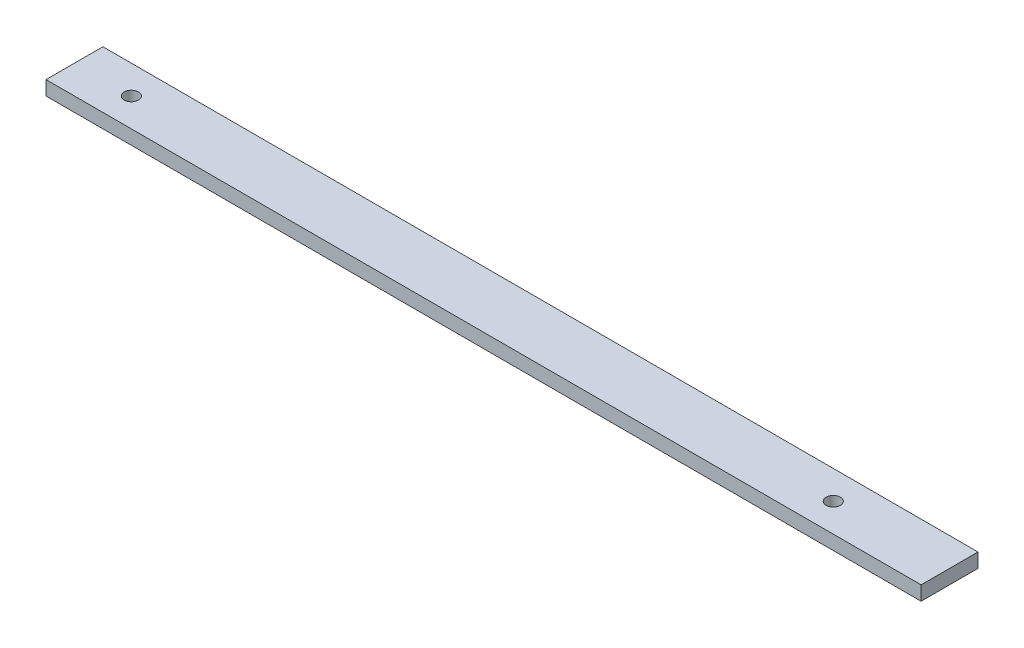
from build123d import *

# Parameters (mm, degrees)
SKETCH1_W           = 390.652
SKETCH1_H           = 25.4
BOSS_EXTRUDE1_DEPTH = 6.35
CUT_EXTRUDE1_REACH  = 393.528
SKETCH2_R           = 3.175


with BuildPart() as part:
    # Sketch1 → Boss-Extrude1 (new body)
    with BuildSketch(Plane(origin=(0, 0, 0), x_dir=(1, 0, 0), z_dir=(0, 1, 0))):
        with Locations((195.326, -12.7)):
            Rectangle(SKETCH1_W, SKETCH1_H)
    extrude(amount=BOSS_EXTRUDE1_DEPTH)

    # Sketch2 → Cut-Extrude1 (cut, up to next)
    with BuildSketch(Plane.XZ, mode=Mode.PRIVATE) as cut_extrude1_sk1:
        with Locations((25.4, 12.7)):
            Circle(SKETCH2_R)
    cut_extrude1_tool1 = extrude(cut_extrude1_sk1.sketch, amount=-CUT_EXTRUDE1_REACH, mode=Mode.PRIVATE) & part.part
    # Sketch2 → Cut-Extrude1 (cut, up to next)
    with BuildSketch(Plane.XZ, mode=Mode.PRIVATE) as cut_extrude1_sk2:
        with Locations((338.738972, 12.7)):
            Circle(SKETCH2_R)
    cut_extrude1_tool2 = extrude(cut_extrude1_sk2.sketch, amount=-CUT_EXTRUDE1_REACH, mode=Mode.PRIVATE) & part.part
    add(cut_extrude1_tool1.solids().sort_by_distance((25.4, 0, 12.7))[0], mode=Mode.SUBTRACT)
    add(cut_extrude1_tool2.solids().sort_by_distance((338.738972, 0, 12.7))[0], mode=Mode.SUBTRACT)


solid = part.part
